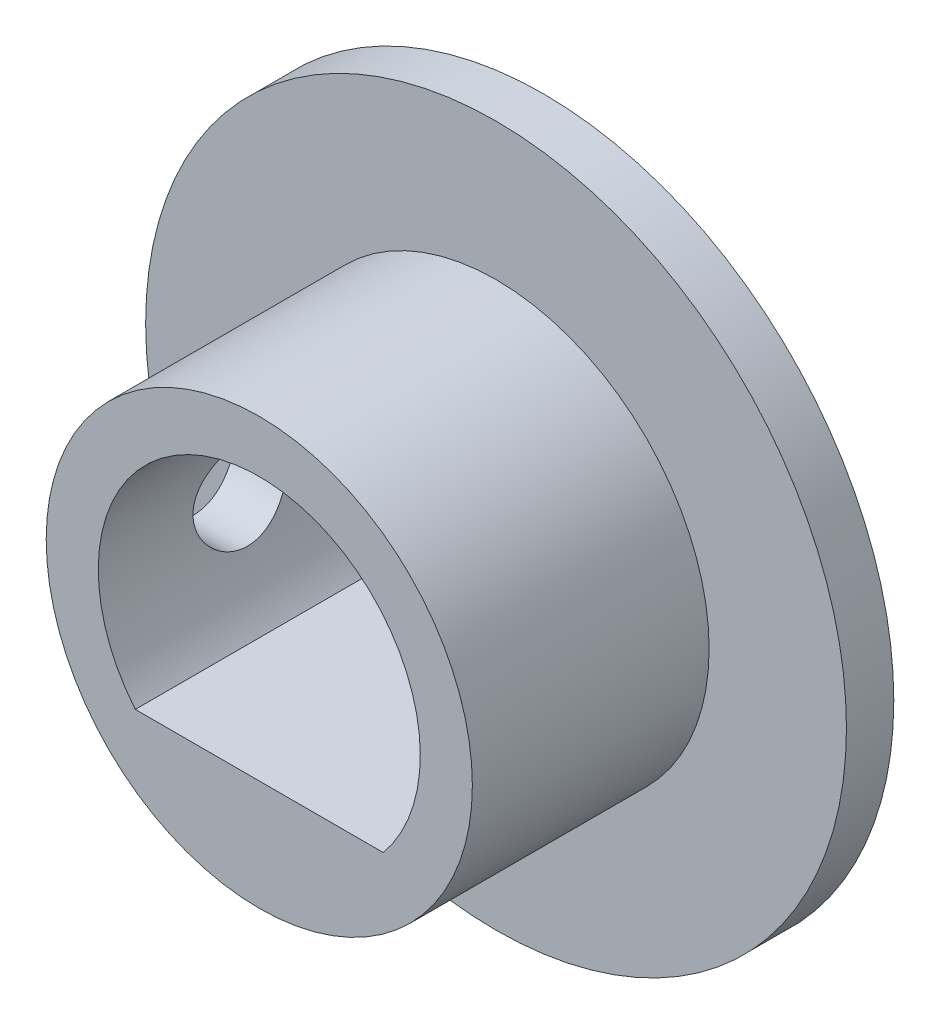
from build123d import *
from build123d.topology import SkipClean

# Parameters (mm, degrees)
ESBO_O1_R                    = 3.7
RESSALTO_EXTRUS_O2_DEPTH     = 6.5
ESBO_O2_R                    = 1.875
CORTE_EXTRUS_O1_DEPTH        = 0.6
ESBO_O3_R                    = 5
ESBO_O3_R_2                  = 2.415
CORTE_EXTRUS_O2_DEPTH        = 5.5
ESBO_O6_R                    = 2.05
CORTE_EXTRUS_O6_DEPTH        = 0.9
ESBO_O7_R                    = 2.415
ESBO_O7_R_2                  = 2.1
CORTE_EXTRUS_O7_DEPTH        = 5.5
RESSALTO_EXTRUS_O3_START     = 3.5
ESBO_O8_R                    = 2.25
ESBO_O8_R_2                  = 2.1
RESSALTO_EXTRUS_O3_DEPTH     = 3.5
RESSALTO_EXTRUS_O4_START     = 3.5
ESBO_O11_R                   = 2.65
ESBO_O11_R_2                 = 2.25
RESSALTO_EXTRUS_O4_DEPTH     = 3.5
ESBO_O9_R                    = 0.5
CORTE_EXTRUS_O8_DEPTH        = 10
ESBO_O13_R                   = 3.7
CORTE_EXTRUS_O10_DEPTH       = 0.5
ESBO_O14_R                   = 2.05
CORTE_EXTRUS_O11_DEPTH       = 0.4
ESBO_O15_W                   = 5.3
ESBO_O15_H                   = 2.277962938
CORTE_EXTRUS_O12_DEPTH       = 5.2
RESSALTO_EXTRUS_O6_START     = 0.8
ESBO_O17_R                   = 2.05
RESSALTO_EXTRUS_O6_DEPTH     = 0.8
CORTE_EXTRUS_O13_START       = -3.5
CORTE_EXTRUS_O13_OUTLINE_R   = 2.65
CORTE_EXTRUS_O13_OUTLINE_R_2 = 2.25
CORTE_EXTRUS_O13_DEPTH       = 3.5
ESBO_O19_W                   = 1.26014474
ESBO_O19_H                   = 6.353969252
CORTE_EXTRUS_O14_DEPTH       = 5
CORTE_EXTRUS_O15_DEPTH       = 10


# Read off the part's stored shape, not the designer's step: Corte-extrusão13
with BuildPart() as part:
    # Esboço1 → Ressalto-extrusão2 (new body)
    with BuildSketch(Plane.XY):
        with Locations(Location((0, 0, 0), (0, 0, 180))):
            Circle(ESBO_O1_R)
        with BuildLine():
            Line((-1.211385827, -0.884615385), (1.211385827, -0.884615385))
            ThreePointArc((1.211385827, -0.884615385), (0, 1.5), (-1.211385827, -0.884615385))
        make_face(mode=Mode.SUBTRACT)
    extrude(amount=RESSALTO_EXTRUS_O2_DEPTH)

    # Esboço2 → Corte-extrusão1 (cut)
    with BuildSketch(Plane(origin=(0, 0, 0), x_dir=(-1, 0, 0), z_dir=(0, 0, -1))):
        Circle(ESBO_O2_R)
    extrude(amount=-CORTE_EXTRUS_O1_DEPTH, mode=Mode.SUBTRACT)

    # Esboço3 → Corte-extrusão2 (cut)
    with BuildSketch(Plane.XY.offset(6.5)):
        Circle(ESBO_O3_R)
        Circle(ESBO_O3_R_2, mode=Mode.SUBTRACT)
    extrude(amount=-CORTE_EXTRUS_O2_DEPTH, mode=Mode.SUBTRACT)

    # Esboço6 → Corte-extrusão6 (cut)
    with BuildSketch(Plane(origin=(0, 0, 0), x_dir=(-1, 0, 0), z_dir=(0, 0, -1))):
        Circle(ESBO_O6_R)
    extrude(amount=-CORTE_EXTRUS_O6_DEPTH, mode=Mode.SUBTRACT)

    # Esboço7 → Corte-extrusão7 (cut)
    with BuildSketch(Plane.XY.offset(6.5)):
        Circle(ESBO_O7_R)
        Circle(ESBO_O7_R_2, mode=Mode.SUBTRACT)
    extrude(amount=-CORTE_EXTRUS_O7_DEPTH, mode=Mode.SUBTRACT)

    # Esboço8 → Ressalto-extrusão3 (add)
    with BuildSketch(Plane.XY.offset(1).offset(RESSALTO_EXTRUS_O3_START)):
        Circle(ESBO_O8_R)
        Circle(ESBO_O8_R_2, mode=Mode.SUBTRACT)
    extrude(amount=-RESSALTO_EXTRUS_O3_DEPTH)

    # Esboço11 → Ressalto-extrusão4 (add)
    with BuildSketch(Plane.XY.offset(1).offset(RESSALTO_EXTRUS_O4_START)):
        Circle(ESBO_O11_R)
        Circle(ESBO_O11_R_2, mode=Mode.SUBTRACT)
    extrude(amount=-RESSALTO_EXTRUS_O4_DEPTH)

    # Esboço9 → Corte-extrusão8 (cut)
    with BuildSketch(Plane(origin=(0, 0, 0), x_dir=(0, 0, -1), z_dir=(1, 0, 0))):
        with Locations((-2, 0)):
            Circle(ESBO_O9_R)
    extrude(amount=-CORTE_EXTRUS_O8_DEPTH, mode=Mode.SUBTRACT)

    # Esboço13 → Corte-extrusão10 (cut)
    with BuildSketch(Plane(origin=(0, 0, 0), x_dir=(-1, 0, 0), z_dir=(0, 0, -1))):
        Circle(ESBO_O13_R)
    extrude(amount=-CORTE_EXTRUS_O10_DEPTH, mode=Mode.SUBTRACT)

    # Esboço14 → Corte-extrusão11 (cut)
    with BuildSketch(Plane(origin=(0, 0, 0.9), x_dir=(-1, 0, 0), z_dir=(0, 0, -1))):
        Circle(ESBO_O14_R)
    extrude(amount=-CORTE_EXTRUS_O11_DEPTH, mode=Mode.SUBTRACT)

    # Esboço15 → Corte-extrusão12 (cut, symmetric)
    with BuildSketch(Plane(origin=(0, 0, 0), x_dir=(1, 0, 0), z_dir=(0, 1, 0))):
        with Locations((0, -5.638981469)):
            Rectangle(ESBO_O15_W, ESBO_O15_H)
    extrude(amount=CORTE_EXTRUS_O12_DEPTH, both=True, mode=Mode.SUBTRACT)

    # Esboço17 → Ressalto-extrusão6 (add)
    with SkipClean():  # the faces are left unmerged after this step: merging them gives an invalid solid
        with BuildSketch(Plane(origin=(0, 0, 1.3), x_dir=(-1, 0, 0), z_dir=(0, 0, -1)).offset(RESSALTO_EXTRUS_O6_START)):
            Circle(ESBO_O17_R)
            with BuildLine():
                Line((-1.211385827, -0.884615385), (1.211385827, -0.884615385))
                ThreePointArc((1.211385827, -0.884615385), (0, 1.5), (-1.211385827, -0.884615385))
            make_face(mode=Mode.SUBTRACT)
        extrude(amount=-RESSALTO_EXTRUS_O6_DEPTH)

    # Corte-extrusão13 outline → Corte-extrusão13 (cut)
    with SkipClean():  # the faces are left unmerged after this step: merging them gives an invalid solid
        with BuildSketch(Plane.XY.offset(4.5).offset(CORTE_EXTRUS_O13_START)):
            Circle(CORTE_EXTRUS_O13_OUTLINE_R)
            Circle(CORTE_EXTRUS_O13_OUTLINE_R_2, mode=Mode.SUBTRACT)
        extrude(amount=CORTE_EXTRUS_O13_DEPTH, mode=Mode.SUBTRACT)

    # Esboço19 → Corte-extrusão14 (cut, symmetric)
    with SkipClean():  # the faces are left unmerged after this step: merging them gives an invalid solid
        with BuildSketch(Plane(origin=(0, 0, 0), x_dir=(0, 0, -1), z_dir=(1, 0, 0))):
            with Locations((-4.13007237, -0.123588244)):
                Rectangle(ESBO_O19_W, ESBO_O19_H)
        extrude(amount=CORTE_EXTRUS_O14_DEPTH, both=True, mode=Mode.SUBTRACT)

    # Esboço20 → Corte-extrusão15 (cut)
    with BuildSketch(Plane(origin=(0, 0, 0.5), x_dir=(-1, 0, 0), z_dir=(0, 0, -1))):
        with BuildLine():
            Line((-1.30904907, -1.084615385), (1.30904907, -1.084615385))
            ThreePointArc((1.30904907, -1.084615385), (0, 1.7), (-1.30904907, -1.084615385))
        make_face()
    extrude(amount=-CORTE_EXTRUS_O15_DEPTH, mode=Mode.SUBTRACT)


solid = part.part
